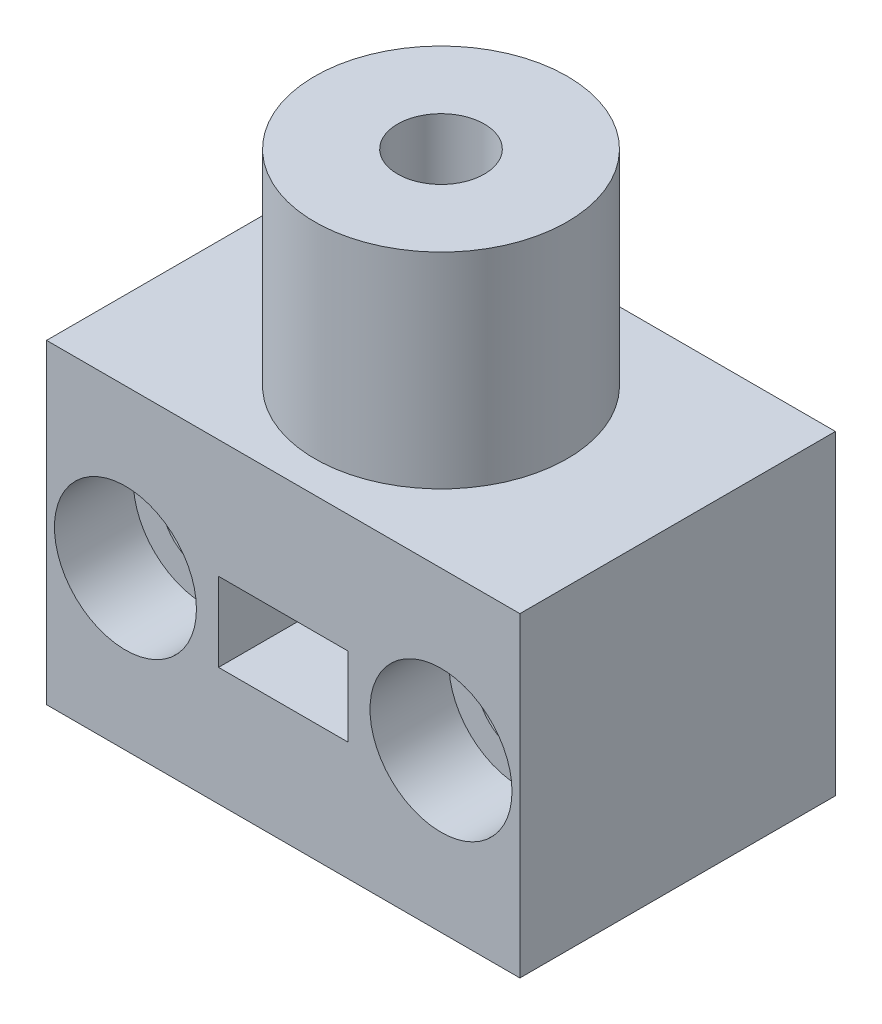
from build123d import *

# Parameters (mm, degrees)
SKETCH1_W           = 30
SKETCH1_H           = 20
BOSS_EXTRUDE1_DEPTH = 20
SKETCH2_R           = 2.75
SKETCH2_W           = 8.2
SKETCH2_H           = 5
CUT_EXTRUDE1_DEPTH  = 42.231056256
SKETCH3_R           = 2.75
CUT_EXTRUDE2_DEPTH  = 42.231056256
BOSS_EXTRUDE2_REACH = 40.161
SKETCH5_W           = 8
SKETCH5_H           = 6
BOSS_EXTRUDE3_DEPTH = 3
SKETCH6_R           = 4.5
CUT_EXTRUDE3_DEPTH  = 5
BOSS_EXTRUDE4_START = 13
SKETCH7_R           = 8
SKETCH7_R_2         = 2.75
BOSS_EXTRUDE4_DEPTH = 13


with BuildPart() as part:
    # Sketch1 → Boss-Extrude1 (new body)
    with BuildSketch(Plane.XY):
        with Locations((15, 10)):
            Rectangle(SKETCH1_W, SKETCH1_H)
    extrude(amount=BOSS_EXTRUDE1_DEPTH)

    # Sketch2 → Cut-Extrude1 (cut, through all)
    with BuildSketch(Plane.XY.offset(20)):
        with Locations((5, 10)):
            Circle(SKETCH2_R)
        with Locations((25, 10)):
            Circle(SKETCH2_R)
        with Locations((15, 10)):
            Rectangle(SKETCH2_W, SKETCH2_H)
    extrude(amount=-CUT_EXTRUDE1_DEPTH, mode=Mode.SUBTRACT)

    # Sketch3 → Cut-Extrude2 (cut, through all)
    with BuildSketch(Plane(origin=(0, 20, 0), x_dir=(1, 0, 0), z_dir=(0, 1, 0))):
        with Locations((15, -10)):
            Circle(SKETCH3_R)
    extrude(amount=-CUT_EXTRUDE2_DEPTH, mode=Mode.SUBTRACT)

    # Sketch4 → Boss-Extrude2 (add, up to next)
    with BuildSketch(Plane(origin=(0, 7.5, 0), x_dir=(1, 0, 0), z_dir=(0, 1, 0)), mode=Mode.PRIVATE) as boss_extrude2_sk1:
        Polygon((19.1, -7.5), (15.1, -5.133920143), (10.9, -7.5), (10.9, 0), (19.1, 0), align=None)
    boss_extrude2_tool1 = extrude(boss_extrude2_sk1.sketch, amount=BOSS_EXTRUDE2_REACH, mode=Mode.PRIVATE) - part.part
    add(boss_extrude2_tool1.solids().sort_by_distance((14.993757, 7.5, 3.195407))[0])

    # Sketch5 → Boss-Extrude3 (add)
    with BuildSketch(Plane(origin=(0, 0, 0), x_dir=(-1, 0, 0), z_dir=(0, 0, -1))):
        with Locations((-15, 10)):
            Rectangle(SKETCH5_W, SKETCH5_H)
    extrude(amount=BOSS_EXTRUDE3_DEPTH)

    # Sketch6 → Cut-Extrude3 (cut)
    with BuildSketch(Plane.XY.offset(20)):
        with Locations((5, 10)):
            Circle(SKETCH6_R)
        with Locations((25, 10)):
            Circle(SKETCH6_R)
    extrude(amount=-CUT_EXTRUDE3_DEPTH, mode=Mode.SUBTRACT)

    # Sketch7 → Boss-Extrude4 (add)
    with BuildSketch(Plane(origin=(0, 20, 0), x_dir=(1, 0, 0), z_dir=(0, 1, 0)).offset(BOSS_EXTRUDE4_START)):
        with Locations((15, -10)):
            Circle(SKETCH7_R)
        with Locations((15, -10)):
            Circle(SKETCH7_R_2, mode=Mode.SUBTRACT)
    extrude(amount=-BOSS_EXTRUDE4_DEPTH)


solid = part.part
